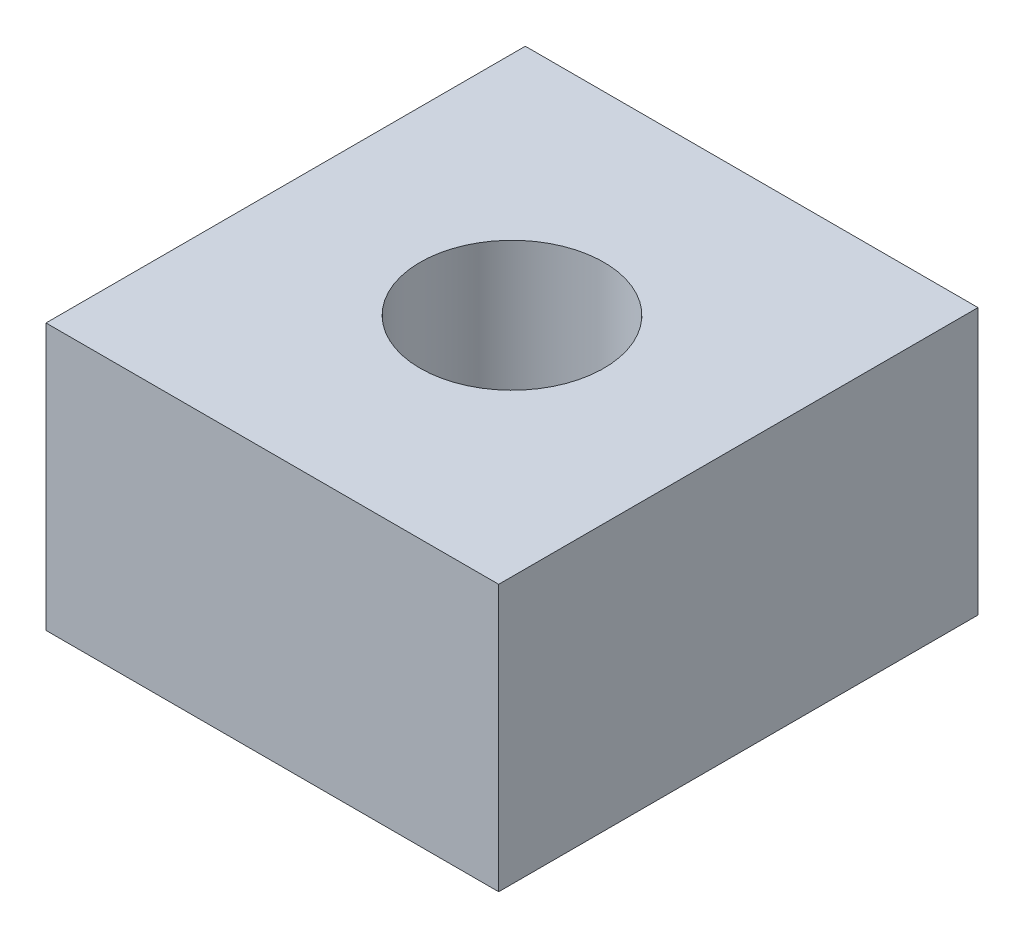
from build123d import *

# Parameters (mm, degrees)
SKETCH1_W           = 17
SKETCH1_H           = 18
BOSS_EXTRUDE1_DEPTH = 10
SKETCH2_R           = 3.45
CUT_EXTRUDE1_DEPTH  = 10


with BuildPart() as part:
    # Sketch1 → Boss-Extrude1 (new body)
    with BuildSketch(Plane(origin=(0, 0, 0), x_dir=(1, 0, 0), z_dir=(0, 1, 0))):
        with Locations((8.5, 9)):
            Rectangle(SKETCH1_W, SKETCH1_H)
    extrude(amount=BOSS_EXTRUDE1_DEPTH)

    # Sketch2 → Cut-Extrude1 (cut)
    with BuildSketch(Plane(origin=(0, 10, 0), x_dir=(1, 0, 0), z_dir=(0, 1, 0))):
        with Locations((8.5, 9)):
            Circle(SKETCH2_R)
    extrude(amount=-CUT_EXTRUDE1_DEPTH, mode=Mode.SUBTRACT)


solid = part.part
